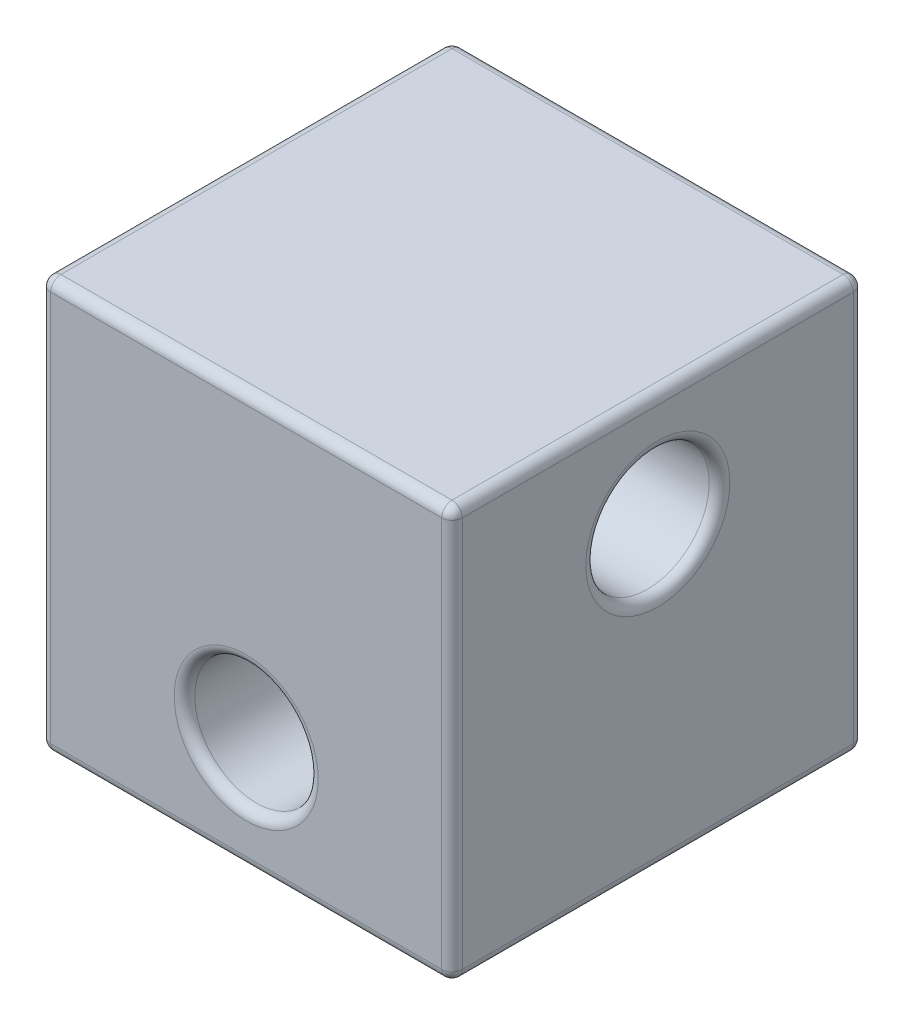
from build123d import *

# Parameters (mm, degrees)
SKETCH1_W           = 40
SKETCH1_H           = 40
BOSS_EXTRUDE1_DEPTH = 20
SKETCH2_R           = 6
CUT_EXTRUDE1_DEPTH  = 49.989794856
SKETCH3_R           = 6
CUT_EXTRUDE2_DEPTH  = 49.989794856
FILLET1_R           = 1


with BuildPart() as part:
    # Sketch1 → Boss-Extrude1 (new, symmetric)
    with BuildSketch(Plane.XY):
        Rectangle(SKETCH1_W, SKETCH1_H)
    extrude(amount=BOSS_EXTRUDE1_DEPTH, both=True)

    # Sketch2 → Cut-Extrude1 (cut, through all)
    with BuildSketch(Plane.XY.offset(20)):
        with Locations((0, -9)):
            Circle(SKETCH2_R)
    extrude(amount=-CUT_EXTRUDE1_DEPTH, mode=Mode.SUBTRACT)

    # Sketch3 → Cut-Extrude2 (cut, through all)
    with BuildSketch(Plane.ZY.offset(20)):
        with Locations((0, 9)):
            Circle(SKETCH3_R)
    extrude(amount=-CUT_EXTRUDE2_DEPTH, mode=Mode.SUBTRACT)

    # Fillet1
    fillet1_edges = [part.edges().sort_by_distance(p)[0] for p in [
        (0, -20, -20),
        (20, -20, 0),
        (20, 0, -20),
        (20, 9, -6),
        (20, 20, 0),
        (0, 20, -20),
        (0, -20, 20),
        (0, 20, 20),
        (20, 0, 20),
        (-6, -9, 20),
        (-20, 20, 0),
        (-20, 0, 20),
        (-20, -20, 0),
        (-20, 0, -20),
        (-20, 9, -6),
        (-6, -9, -20),
    ]]
    fillet(fillet1_edges, radius=FILLET1_R)


solid = part.part
